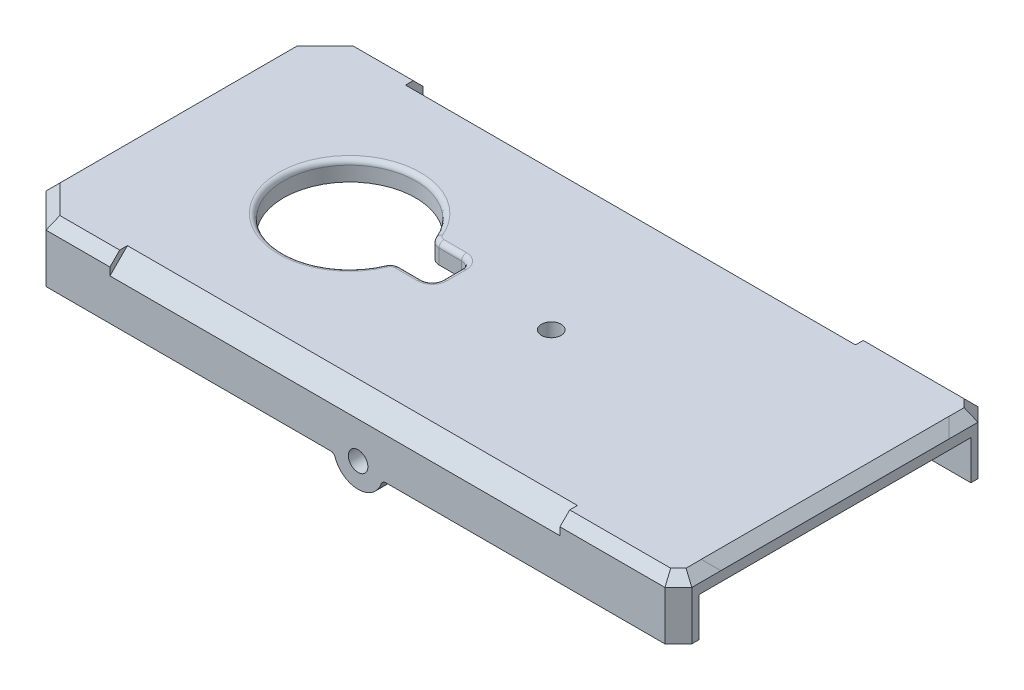
from build123d import *

# Parameters (mm, degrees)
BOSS_EXTRUDE1_DEPTH      = 2
BOSS_EXTRUDE2_DEPTH      = 2
BOSS_EXTRUDE2_DEPTH_BACK = 4
CHAMFER2_SIZE            = 1
CUT_EXTRUDE3_DEPTH       = 6
CHAMFER3_SIZE            = 1
CHAMFER4_SIZE            = 1
SKETCH5_W                = 27.8
SKETCH5_H                = 4
CUT_EXTRUDE4_DEPTH       = 6
FILLET1_R                = 0.5
CUT_EXTRUDE5_START       = -10
CUT_EXTRUDE5_DEPTH       = 46
SKETCH7_R                = 2.5
BOSS_EXTRUDE3_DEPTH      = 2.1
FILLET2_R                = 0.5
SKETCH8_R                = 2.5
BOSS_EXTRUDE4_DEPTH      = 2.1
FILLET3_R                = 0.5
SKETCH9_R                = 1
CUT_EXTRUDE6_DEPTH       = 46
SKETCH10_R               = 1
CUT_EXTRUDE7_DEPTH       = 6
SKETCH11_R               = 1
CUT_EXTRUDE8_DEPTH       = 10
BOSS_EXTRUDE5_START      = 4
SKETCH12_W               = 5.064195868
SKETCH12_H               = 0.781312031
SKETCH12_H_2             = 0.784523075
BOSS_EXTRUDE5_DEPTH      = 4
BOSS_EXTRUDE6_START      = 4
SKETCH12_4_W             = 5.064195868
SKETCH12_4_H             = 0.781312031
SKETCH12_4_H_2           = 0.784523075
BOSS_EXTRUDE6_DEPTH      = 2
CUT_EXTRUDE9_REACH       = 43.972
SKETCH14_W               = 3.543409349
SKETCH14_H               = 1.728514359


with BuildPart() as part:
    # Sketch1 → Boss-Extrude1 (new body)
    # profile 1 of 2: a face of its own
    with BuildSketch(Plane(origin=(0, 0, 0), x_dir=(1, 0, 0), z_dir=(0, 1, 0))):
        Polygon((32.729021504, 4.406467745), (32.729021504, 12.07215317), (30.494706929, 14.306467745), (-31.036663921, 14.306467745), (-33.270978496, 12.07215317), (-33.270978496, -11.25921768), (-31.036663921, -13.493532255), (30.494706929, -13.493532255), (32.729021504, -11.25921768), (32.729021504, -3.593532255), align=None)
        Polygon((32.329021504, 4.406467745), (32.329021504, 11.906467745), (30.329021504, 13.906467745), (-30.870978496, 13.906467745), (-32.870978496, 11.906467745), (-32.870978496, -11.093532255), (-30.870978496, -13.093532255), (30.329021504, -13.093532255), (32.329021504, -11.093532255), (32.329021504, -3.593532255), align=None, mode=Mode.SUBTRACT)
    # profile 2 of 2: a face of its own
    with BuildSketch(Plane(origin=(0, 0, 0), x_dir=(1, 0, 0), z_dir=(0, 1, 0))):
        Polygon((32.329021504, 4.406467745), (32.329021504, -3.593532255), (32.329021504, -11.093532255), (30.329021504, -13.093532255), (-30.870978496, -13.093532255), (-32.870978496, -11.093532255), (-32.870978496, 11.906467745), (-30.870978496, 13.906467745), (30.329021504, 13.906467745), (32.329021504, 11.906467745), align=None)
        with BuildLine():
            ThreePointArc((-9.725175532, 2.406467745), (-10.278756252, 2.573672219), (-10.647214625, 3.01937097))
            ThreePointArc((-10.647214625, 3.01937097), (-23.620978496, 0.406467745), (-10.647214625, -2.206435481))
            ThreePointArc((-10.647214625, -2.206435481), (-10.278756252, -1.76073673), (-9.725175532, -1.593532255))
            Line((-9.725175532, -1.593532255), (-7.424080017, -1.593532255))
            ThreePointArc((-7.424080017, -1.593532255), (-6.716973236, -1.300639037), (-6.424080017, -0.593532255))
            Line((-6.424080017, -0.593532255), (-6.424080017, 1.406467745))
            ThreePointArc((-6.424080017, 1.406467745), (-6.716973236, 2.113574526), (-7.424080017, 2.406467745))
            Line((-7.424080017, 2.406467745), (-9.725175532, 2.406467745))
        make_face(mode=Mode.SUBTRACT)
    extrude(amount=BOSS_EXTRUDE1_DEPTH)

    # Chamfer4
    chamfer4_edges = [part.edges().sort_by_distance(p)[0] for p in [
        (32.729021504, 2, -0.406467745),
    ]]
    chamfer(chamfer4_edges, length=CHAMFER4_SIZE)

    # Fillet1
    fillet1_edges = [part.edges().sort_by_distance(p)[0] for p in [
        (-8.574627775, 2, -2.406467745),
        (-6.716973236, 2, -2.113574526),
        (-6.424080017, 2, -0.406467745),
        (-6.716973236, 2, 1.300639037),
        (-8.574627775, 2, 1.593532255),
        (-10.278756252, 2, 1.76073673),
        (-23.620978496, 2, -0.406467745),
        (-10.278756252, 2, -2.573672219),
    ]]
    fillet(fillet1_edges, radius=FILLET1_R)

    # Sketch11 → Cut-Extrude8 (cut)
    with BuildSketch(Plane(origin=(0, 2, 0), x_dir=(1, 0, 0), z_dir=(0, 1, 0))):
        with Locations(Location((3.743408684, 0.406467745, 0), (0, 0, 270))):
            Circle(SKETCH11_R)
    extrude(amount=-CUT_EXTRUDE8_DEPTH, mode=Mode.SUBTRACT)


with BuildPart() as body_2:
    # Sketch1<3> → Boss-Extrude2 (new, two sides: drawn at the far end of the back side and taken through both)
    with BuildSketch(Plane(origin=(0, 0, 0), x_dir=(1, 0, 0), z_dir=(0, 1, 0)).offset(-BOSS_EXTRUDE2_DEPTH_BACK)):
        Polygon((34.829021504, 12.942001651), (31.36455541, 16.406467745), (-31.906512402, 16.406467745), (-35.370978496, 12.942001651), (-35.370978496, -12.129066161), (-31.906512402, -15.593532255), (31.36455541, -15.593532255), (34.829021504, -12.129066161), (34.829021504, -3.593532255), (34.829021504, 4.406467745), align=None)
        Polygon((32.729021504, 12.07215317), (30.494706929, 14.306467745), (-31.036663921, 14.306467745), (-33.270978496, 12.07215317), (-33.270978496, -11.25921768), (-31.036663921, -13.493532255), (30.494706929, -13.493532255), (32.729021504, -11.25921768), (32.729021504, -3.593532255), (32.729021504, 4.406467745), align=None, mode=Mode.SUBTRACT)
    extrude(amount=BOSS_EXTRUDE2_DEPTH + BOSS_EXTRUDE2_DEPTH_BACK)

    # Chamfer2
    chamfer2_edges = [body_2.edges().sort_by_distance(p)[0] for p in [
        (-0.270978496, 2, -16.406467745),
        (-33.638745449, 2, -14.674234698),
        (-35.370978496, 2, -0.406467745),
        (-33.638745449, 2, 13.861299208),
        (-0.270978496, 2, 15.593532255),
        (33.096788457, 2, 13.861299208),
        (34.829021504, 2, -0.406467745),
        (33.096788457, 2, -14.674234698),
    ]]
    chamfer(chamfer2_edges, length=CHAMFER2_SIZE)

    # Sketch4 → Cut-Extrude3 (cut)
    with BuildSketch(Plane(origin=(0, 2, 0), x_dir=(1, 0, 0), z_dir=(0, 1, 0))):
        Polygon((32.736607325, 12.100069105), (32.736607325, 15.066969795), (34.829021504, 12.974555617), (34.829021504, -12.129066161), (32.736607325, -14.22148034), (32.736607325, -11.231301745), align=None)
    extrude(amount=-CUT_EXTRUDE3_DEPTH, mode=Mode.SUBTRACT)

    # Chamfer3
    # the kernel refuses this chamfer: 1 mm, written as the material it takes off along each edge
    with BuildSketch(Plane(origin=(32.736607325, 2, 15.378949765), x_dir=(0.02749587661058907, -0.9996219169112965, 0), z_dir=(0, 0, -1))) as chamfer3_piece_1:
        Polygon((CHAMFER3_SIZE * 0.999621916911, CHAMFER3_SIZE * 0.0274958766106), (-CHAMFER3_SIZE * 0.0274958766106, CHAMFER3_SIZE * 0.999621916911), (0, 0), align=None)
    extrude(amount=31.57083502, mode=Mode.SUBTRACT)

    # Sketch5 → Cut-Extrude4 (cut)
    with BuildSketch(Plane(origin=(32.736607325, 0, 0), x_dir=(0, 0, -1), z_dir=(1, 0, 0))):
        with Locations((0.406467745, -2)):
            Rectangle(SKETCH5_W, SKETCH5_H)
    extrude(amount=-CUT_EXTRUDE4_DEPTH, mode=Mode.SUBTRACT)

    # Sketch6 → Cut-Extrude5 (cut)
    with BuildSketch(Plane.ZY.offset(35.370978496).offset(CUT_EXTRUDE5_START)):
        Polygon((-14.620202266, 2), (-16.406467745, 0.213734522), (-16.406467745, 2), align=None)
        Polygon((15.593532255, 2), (13.807266777, 2), (15.593532255, 0.213734522), align=None)
    extrude(amount=-CUT_EXTRUDE5_DEPTH, mode=Mode.SUBTRACT)

    # Sketch7 → Boss-Extrude3 (add)
    with BuildSketch(Plane.XY.offset(15.593532255)):
        with Locations((0, -3.5)):
            Circle(SKETCH7_R)
    extrude(amount=-BOSS_EXTRUDE3_DEPTH)

    # Fillet2
    fillet2_edges = [body_2.edges().sort_by_distance(p)[0] for p in [
        (2.449489743, -4, 14.543532255),
        (-2.449489743, -4, 14.543532255),
    ]]
    fillet(fillet2_edges, radius=FILLET2_R)

    # Sketch8 → Boss-Extrude4 (add)
    with BuildSketch(Plane.ZY.offset(35.370978496)):
        with Locations((-0.406467745, -3.5)):
            Circle(SKETCH8_R)
    extrude(amount=-BOSS_EXTRUDE4_DEPTH)

    # Fillet3
    fillet3_edges = [body_2.edges().sort_by_distance(p)[0] for p in [
        (-34.320978496, -4, -2.855957487),
        (-34.320978496, -4, 2.043021998),
    ]]
    fillet(fillet3_edges, radius=FILLET3_R)

    # Sketch9 → Cut-Extrude6 (cut)
    with BuildSketch(Plane.ZY.offset(35.370978496)):
        with Locations((-0.406467745, -3.5)):
            Circle(SKETCH9_R)
    extrude(amount=-CUT_EXTRUDE6_DEPTH, mode=Mode.SUBTRACT)

    # Sketch10 → Cut-Extrude7 (cut)
    with BuildSketch(Plane.XY.offset(15.593532255)):
        with Locations((0, -3.5)):
            Circle(SKETCH10_R)
    extrude(amount=-CUT_EXTRUDE7_DEPTH, mode=Mode.SUBTRACT)


    add(part.part)  # Boss-Extrude5 merges part
    # Sketch12 → Boss-Extrude5 (add)
    with BuildSketch(Plane(origin=(0, 0, 0), x_dir=(-1, 0, 0), z_dir=(0, -1, 0)).offset(BOSS_EXTRUDE5_START)):
        with Locations((7.956177951, 5.79712376)):
            Rectangle(SKETCH12_W, SKETCH12_H)
        with BuildLine():
            Line((5.424080017, -4.593532255), (6.428321603, -4.593532255))
            Line((6.428321603, -4.593532255), (6.428321603, -0.685538667))
            ThreePointArc((6.428321603, -0.685538667), (6.425140976, -0.639584321), (6.424080017, -0.593532255))
            Line((6.424080017, -0.593532255), (6.424080017, 1.406467745))
            ThreePointArc((6.424080017, 1.406467745), (6.425140976, 1.45251981), (6.428321603, 1.498474156))
            Line((6.428321603, 1.498474156), (6.428321603, 5.406467745))
            Line((6.428321603, 5.406467745), (5.424080017, 5.406467745))
            Line((5.424080017, 5.406467745), (5.424080017, -4.593532255))
        make_face()
        with Locations((7.956177951, -4.985793793)):
            Rectangle(SKETCH12_W, SKETCH12_H_2)
    extrude(amount=-BOSS_EXTRUDE5_DEPTH)

    # Sketch12<4> → Boss-Extrude6 (add)
    with BuildSketch(Plane(origin=(0, 0, 0), x_dir=(-1, 0, 0), z_dir=(0, -1, 0)).offset(BOSS_EXTRUDE6_START)):
        with BuildLine():
            ThreePointArc((9.725175532, 2.406467745), (10.145722789, 2.499197109), (10.488275885, 2.760187734))
            Line((10.488275885, 2.760187734), (10.488275885, 5.406467745))
            Line((10.488275885, 5.406467745), (6.428321603, 5.406467745))
            Line((6.428321603, 5.406467745), (6.428321603, 1.498474156))
            ThreePointArc((6.428321603, 1.498474156), (6.750287175, 2.145388042), (7.424080017, 2.406467745))
            Line((7.424080017, 2.406467745), (9.725175532, 2.406467745))
        make_face()
        with BuildLine():
            Line((6.428321603, -4.593532255), (10.488275885, -4.593532255))
            Line((10.488275885, -4.593532255), (10.488275885, -1.947252245))
            ThreePointArc((10.488275885, -1.947252245), (10.145722789, -1.68626162), (9.725175532, -1.593532255))
            Line((9.725175532, -1.593532255), (7.424080017, -1.593532255))
            ThreePointArc((7.424080017, -1.593532255), (6.750287175, -1.332452553), (6.428321603, -0.685538667))
            Line((6.428321603, -0.685538667), (6.428321603, -4.593532255))
        make_face()
        with BuildLine():
            Line((5.424080017, -4.593532255), (6.428321603, -4.593532255))
            Line((6.428321603, -4.593532255), (6.428321603, -0.685538667))
            ThreePointArc((6.428321603, -0.685538667), (6.425140976, -0.639584321), (6.424080017, -0.593532255))
            Line((6.424080017, -0.593532255), (6.424080017, 1.406467745))
            ThreePointArc((6.424080017, 1.406467745), (6.425140976, 1.45251981), (6.428321603, 1.498474156))
            Line((6.428321603, 1.498474156), (6.428321603, 5.406467745))
            Line((6.428321603, 5.406467745), (5.424080017, 5.406467745))
            Line((5.424080017, 5.406467745), (5.424080017, -4.593532255))
        make_face()
        with Locations((7.956177951, 5.79712376)):
            Rectangle(SKETCH12_4_W, SKETCH12_4_H)
        with BuildLine():
            ThreePointArc((9.725175532, -1.593532255), (10.145722789, -1.68626162), (10.488275885, -1.947252245))
            Line((10.488275885, -1.947252245), (10.488275885, 2.760187734))
            ThreePointArc((10.488275885, 2.760187734), (10.145722789, 2.499197109), (9.725175532, 2.406467745))
            Line((9.725175532, 2.406467745), (7.424080017, 2.406467745))
            ThreePointArc((7.424080017, 2.406467745), (6.750287175, 2.145388042), (6.428321603, 1.498474156))
            Line((6.428321603, 1.498474156), (6.428321603, -0.685538667))
            ThreePointArc((6.428321603, -0.685538667), (6.750287175, -1.332452553), (7.424080017, -1.593532255))
            Line((7.424080017, -1.593532255), (9.725175532, -1.593532255))
        make_face()
        with Locations((7.956177951, -4.985793793)):
            Rectangle(SKETCH12_4_W, SKETCH12_4_H_2)
        with BuildLine():
            ThreePointArc((6.424080017, -0.593532255), (6.425140976, -0.639584321), (6.428321603, -0.685538667))
            Line((6.428321603, -0.685538667), (6.428321603, 1.498474156))
            ThreePointArc((6.428321603, 1.498474156), (6.425140976, 1.45251981), (6.424080017, 1.406467745))
            Line((6.424080017, 1.406467745), (6.424080017, -0.593532255))
        make_face()
    extrude(amount=BOSS_EXTRUDE6_DEPTH)

    # Cut-Extrude9: up to this face of the body (flat: up to its plane)
    cut_extrude9_end = Plane(body_2.part.faces().sort_by_distance((-7.956177951, -3, -6.187779776))[0])
    # Sketch14 → Cut-Extrude9 (cut, up to the picked face)
    with BuildSketch(Plane.XY.offset(5.37805533), mode=Mode.PRIVATE) as cut_extrude9_sk1:
        with Locations((-7.953470858, -0.86425718)):
            Rectangle(SKETCH14_W, SKETCH14_H)
    cut_extrude9_tool1 = split(extrude(cut_extrude9_sk1.sketch, amount=-CUT_EXTRUDE9_REACH, mode=Mode.PRIVATE), bisect_by=cut_extrude9_end, keep=Keep.BOTH, mode=Mode.PRIVATE)
    add(cut_extrude9_tool1.solids().sort_by(Axis((-7.953471, -0.864257, 5.378055), (0, 0, -1)))[0], mode=Mode.SUBTRACT)


solid = body_2.part
